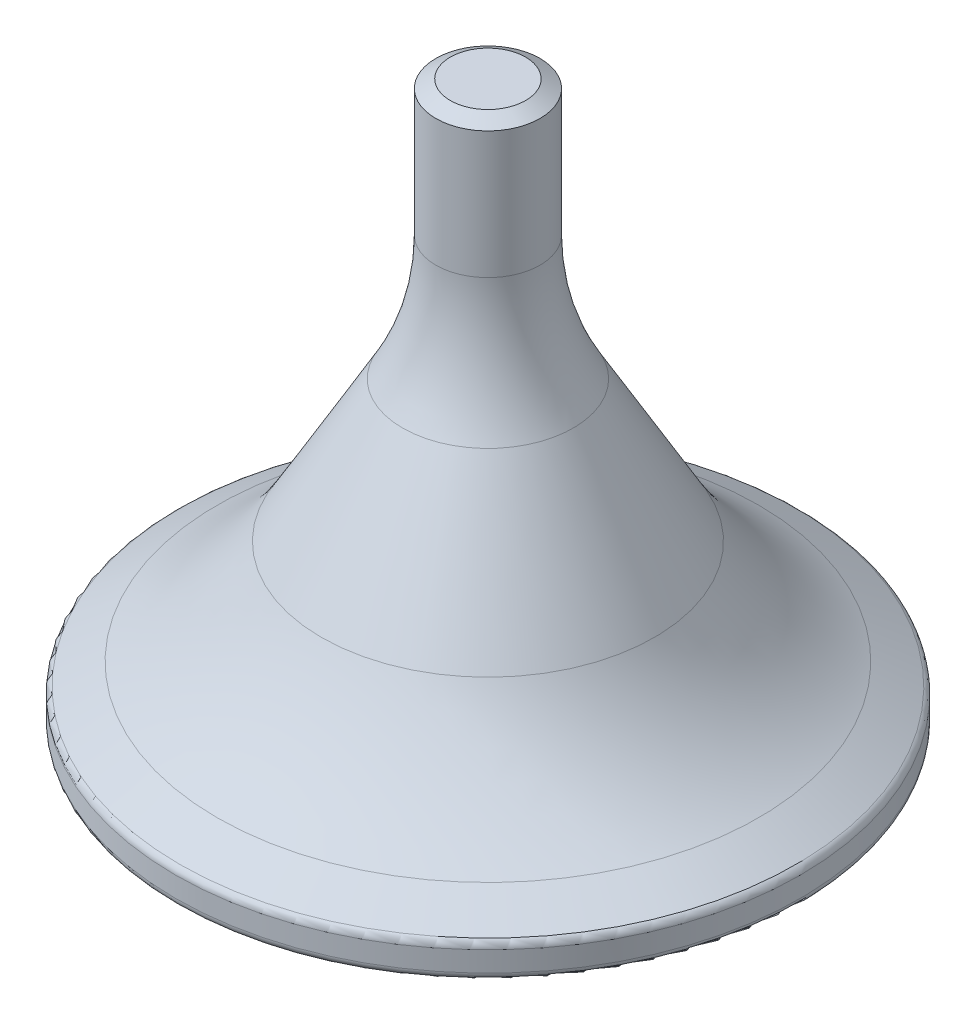
from build123d import *

# Parameters (mm, degrees)
FILLET1_R          = 0.508
CHAMFER1_SIZE      = 0.508
CHAMFER1_SIZE2     = 0.87988181
SKETCH4_W          = 19.05
SKETCH4_H          = 3.175
CUT_EXTRUDE1_DEPTH = 4.7625
FILLET2_R          = 1.5875


with BuildPart() as part:
    # Sketch3 → Revolve1 (revolve)
    with BuildSketch(Plane(origin=(0, 0, 0), x_dir=(0, 0, -1), z_dir=(1, 0, 0)), mode=Mode.PRIVATE) as revolve1_sk:
        with BuildLine():
            Line((0, 0), (3.175, 0))
            Line((3.175, 0), (3.175, -8.255))
            ThreePointArc((3.175, -8.255), (3.691804849, -12.180522558), (5.207, -15.838527241))
            Line((5.207, -15.838527241), (10.16, -24.417374891))
            ThreePointArc((10.16, -24.417374891), (12.91700332, -28.010371571), (16.51, -30.767374891))
            Line((16.51, -30.767374891), (19.05, -32.233844575))
            Line((19.05, -32.233844575), (19.05, -34.265844575))
            Line((19.05, -34.265844575), (0, -34.265844575))
            Line((0, -34.265844575), (0, 0))
        make_face()
    revolve(revolve1_sk.sketch.rotate(Axis((0, 0, 0), (0, -1, 0)), 180), axis=Axis((0, 0, 0), (0, -1, 0)))

    # Fillet1
    fillet1_edges = [part.edges().sort_by_distance(p)[0] for p in [
        (0, -32.233844575, -19.05),
        (0, -34.265844575, -19.05),
    ]]
    fillet(fillet1_edges, radius=FILLET1_R)

    # Chamfer1
    chamfer1_edges = [part.edges().sort_by_distance(p)[0] for p in [
        (0, 0, -3.175),
    ]]
    chamfer1_side = [part.faces().sort_by_distance(p)[0] for p in [
        (0, -4.1275, -3.175),
    ]]
    chamfer(chamfer1_edges, length=CHAMFER1_SIZE, length2=CHAMFER1_SIZE2, reference=chamfer1_side[0])

    # Sketch4 → Cut-Extrude1 (cut)
    with BuildSketch(Plane.XZ.offset(34.265844575)):
        Rectangle(SKETCH4_W, SKETCH4_H)
    extrude(amount=-CUT_EXTRUDE1_DEPTH, mode=Mode.SUBTRACT)

    # Fillet2
    fillet2_edges = [part.edges().sort_by_distance(p)[0] for p in [
        (-9.525, -31.884594575, -1.5875),
        (9.525, -31.884594575, -1.5875),
        (9.525, -31.884594575, 1.5875),
        (-9.525, -31.884594575, 1.5875),
    ]]
    fillet(fillet2_edges, radius=FILLET2_R - 0.0001)  # a hair under: the kernel refuses the full size


solid = part.part
